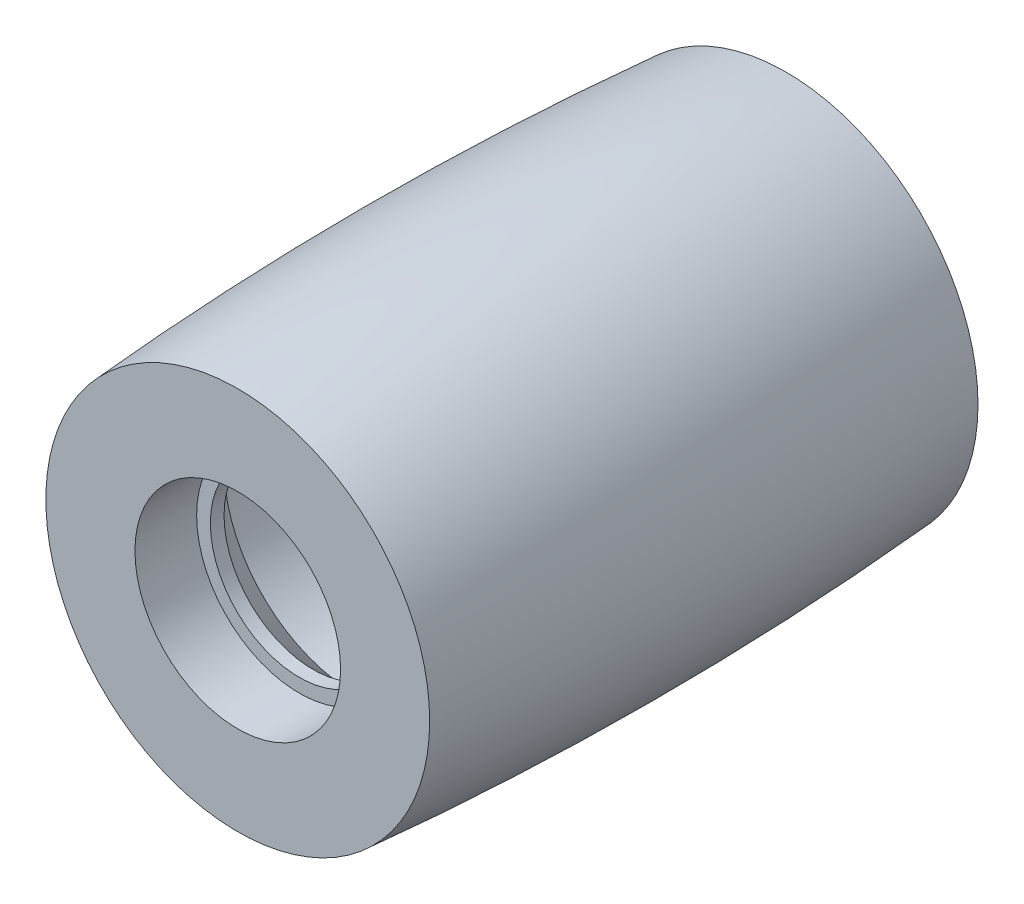
from build123d import *


with BuildPart() as part:
    # Skizze1 → Rotation1 (revolve)
    with BuildSketch(Plane(origin=(0, 0, 0), x_dir=(0, 0, -1), z_dir=(1, 0, 0))):
        with BuildLine():
            Line((10, 28), (10, 15))
            Line((10, 15), (19, 15))
            Line((19, 15), (19, 13))
            Line((19, 13), (21, 13))
            Line((21, 13), (27.25, 19.25))
            Line((27.25, 19.25), (43.3, 19.25))
            Line((43.3, 19.25), (43.3, 11))
            Line((43.3, 11), (46.3, 11))
            Line((46.3, 11), (46.3, 19.25))
            Line((46.3, 19.25), (85, 19.25))
            Line((85, 19.25), (87.144506921, 20.25))
            Line((87.144506921, 20.25), (90, 20.25))
            Line((90, 20.25), (90, 28))
            ThreePointArc((90, 28), (50, 29.5), (10, 28))
        make_face()
    revolve(axis=Axis((0, 0, 0), (0, 0, -1)))


solid = part.part
